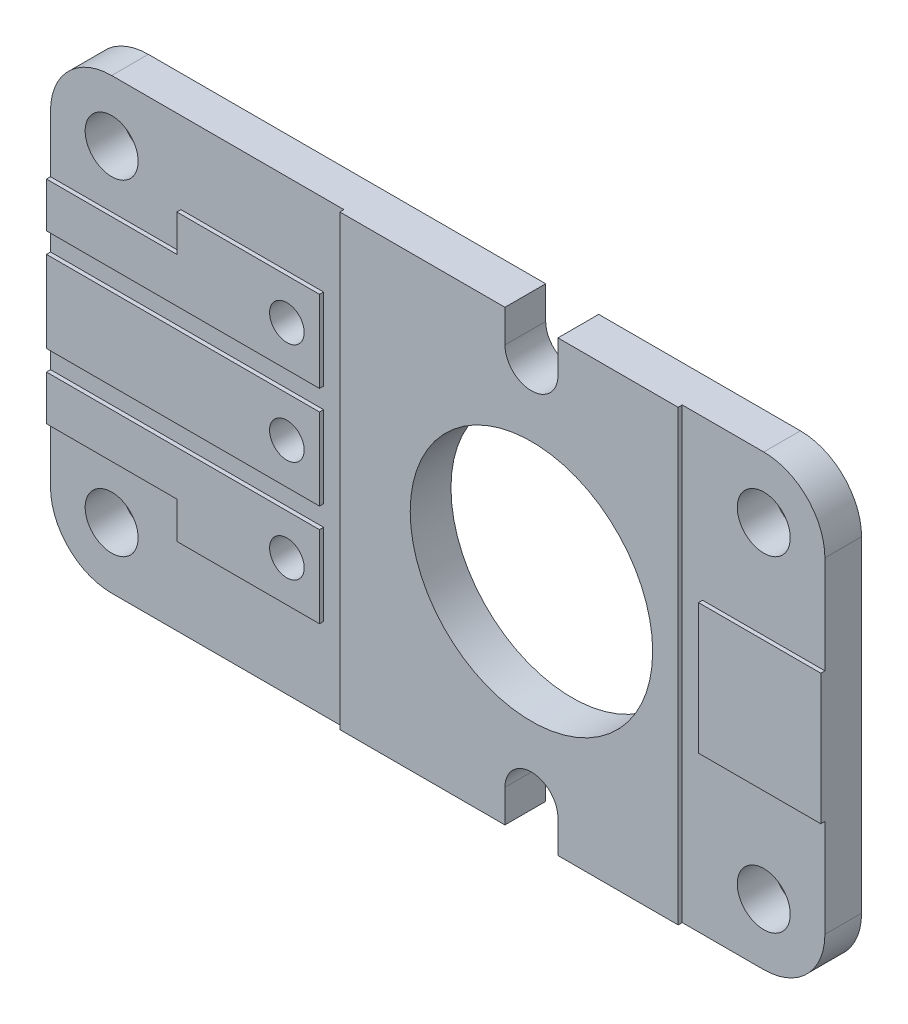
from build123d import *

# Parameters (mm, degrees)
MODEL_R             = 0.65
MODEL_R_2           = 0.4246118
MODEL_R_3           = 2.974594
EXTRUDE_1_DEPTH     = 0.5
SKETCH_2_R          = 0.65
CUT_EXTRUDE_1_DEPTH = 0.1


with BuildPart() as part:
    # Model → Бобышка-Вытянуть1 (new, symmetric)
    with BuildSketch(Plane.XY):
        with BuildLine():
            ThreePointArc((1025.68859, -762.8000398), (1025.03859, -763.4500398), (1024.38859, -762.8000398))
            Line((1024.38859, -762.8000398), (1024.38859, -762.0000398))
            Line((1024.38859, -762.0000398), (1014.63859, -762.0000398))
            ThreePointArc((1014.63859, -762.0000398), (1013.577929828, -762.439379628), (1013.13859, -763.5000398))
            Line((1013.13859, -763.5000398), (1013.13859, -771.5000398))
            ThreePointArc((1013.13859, -771.5000398), (1013.577929828, -772.560699972), (1014.63859, -773.0000398))
            Line((1014.63859, -773.0000398), (1024.38859, -773.0000398))
            Line((1024.38859, -773.0000398), (1024.38859, -772.2000398))
            ThreePointArc((1024.38859, -772.2000398), (1025.03859, -771.5500398), (1025.68859, -772.2000398))
            Line((1025.68859, -772.2000398), (1025.68859, -773.0000398))
            Line((1025.68859, -773.0000398), (1030.63859, -773.0000398))
            ThreePointArc((1030.63859, -773.0000398), (1031.699250172, -772.560699972), (1032.13859, -771.5000398))
            Line((1032.13859, -771.5000398), (1032.13859, -763.5000398))
            ThreePointArc((1032.13859, -763.5000398), (1031.699250172, -762.439379628), (1030.63859, -762.0000398))
            Line((1030.63859, -762.0000398), (1025.68859, -762.0000398))
            Line((1025.68859, -762.0000398), (1025.68859, -762.8000398))
        make_face()
        with Locations((1030.63859, -763.5000398)):
            Circle(MODEL_R, mode=Mode.SUBTRACT)
        with Locations((1030.63859, -771.5000398)):
            Circle(MODEL_R, mode=Mode.SUBTRACT)
        with Locations((1014.63859, -771.5000398)):
            Circle(MODEL_R, mode=Mode.SUBTRACT)
        with Locations((1014.63859, -763.5000398)):
            Circle(MODEL_R, mode=Mode.SUBTRACT)
        with Locations((1019.0385766, -770.0000348)):
            Circle(MODEL_R_2, mode=Mode.SUBTRACT)
        with Locations((1019.03784, -767.4991)):
            Circle(MODEL_R_2, mode=Mode.SUBTRACT)
        with Locations((1019.0385766, -765.0000448)):
            Circle(MODEL_R_2, mode=Mode.SUBTRACT)
        with Locations((1025.03859, -767.5000398)):
            Circle(MODEL_R_3, mode=Mode.SUBTRACT)
    extrude(amount=EXTRUDE_1_DEPTH, both=True)

    # Эскиз2 → Вырез-Вытянуть1 (cut)
    # profile 1 of 2: a face of its own
    with BuildSketch(Plane.XY.offset(0.5)):
        with BuildLine():
            Line((1030.63859, -762.0000398), (1028.63859, -762.0000398))
            Line((1028.63859, -762.0000398), (1028.63859, -773.0000398))
            Line((1028.63859, -773.0000398), (1030.63859, -773.0000398))
            ThreePointArc((1030.63859, -773.0000398), (1031.699250172, -772.560699972), (1032.13859, -771.5000398))
            Line((1032.13859, -771.5000398), (1032.13859, -769.1000398))
            Line((1032.13859, -769.1000398), (1029.13859, -769.1000398))
            Line((1029.13859, -769.1000398), (1029.13859, -765.9000398))
            Line((1029.13859, -765.9000398), (1032.13859, -765.9000398))
            Line((1032.13859, -765.9000398), (1032.13859, -763.5000398))
            ThreePointArc((1032.13859, -763.5000398), (1031.699250172, -762.439379628), (1030.63859, -762.0000398))
        make_face()
        with Locations((1030.63859, -763.5000398)):
            Circle(SKETCH_2_R, mode=Mode.SUBTRACT)
        with Locations((1030.63859, -771.5000398)):
            Circle(SKETCH_2_R, mode=Mode.SUBTRACT)
    # profile 2 of 2: a face of its own
    with BuildSketch(Plane.XY.offset(0.5)):
        with BuildLine():
            Line((1013.13859, -764.9000398), (1016.33859, -764.9000398))
            Line((1016.33859, -764.9000398), (1016.33859, -764.0000398))
            Line((1016.33859, -764.0000398), (1019.83859, -764.0000398))
            Line((1019.83859, -764.0000398), (1019.83859, -766.0000398))
            Line((1019.83859, -766.0000398), (1013.13859, -766.0000398))
            Line((1013.13859, -766.0000398), (1013.13859, -766.5000398))
            Line((1013.13859, -766.5000398), (1019.83859, -766.5000398))
            Line((1019.83859, -766.5000398), (1019.83859, -768.5000398))
            Line((1019.83859, -768.5000398), (1013.13859, -768.5000398))
            Line((1013.13859, -768.5000398), (1013.13859, -769.0000398))
            Line((1013.13859, -769.0000398), (1019.83859, -769.0000398))
            Line((1019.83859, -769.0000398), (1019.83859, -771.0000398))
            Line((1019.83859, -771.0000398), (1016.33859, -771.0000398))
            Line((1016.33859, -771.0000398), (1016.33859, -770.1000398))
            Line((1016.33859, -770.1000398), (1013.13859, -770.1000398))
            Line((1013.13859, -770.1000398), (1013.13859, -771.5000398))
            ThreePointArc((1013.13859, -771.5000398), (1013.577929828, -772.560699972), (1014.63859, -773.0000398))
            Line((1014.63859, -773.0000398), (1020.33859, -773.0000398))
            Line((1020.33859, -773.0000398), (1020.33859, -762.0000398))
            Line((1020.33859, -762.0000398), (1014.63859, -762.0000398))
            ThreePointArc((1014.63859, -762.0000398), (1013.577929828, -762.439379628), (1013.13859, -763.5000398))
            Line((1013.13859, -763.5000398), (1013.13859, -764.9000398))
        make_face()
        with Locations((1014.63859, -771.5000398)):
            Circle(SKETCH_2_R, mode=Mode.SUBTRACT)
        with Locations((1014.63859, -763.5000398)):
            Circle(SKETCH_2_R, mode=Mode.SUBTRACT)
    extrude(amount=-CUT_EXTRUDE_1_DEPTH, mode=Mode.SUBTRACT)


solid = part.part
